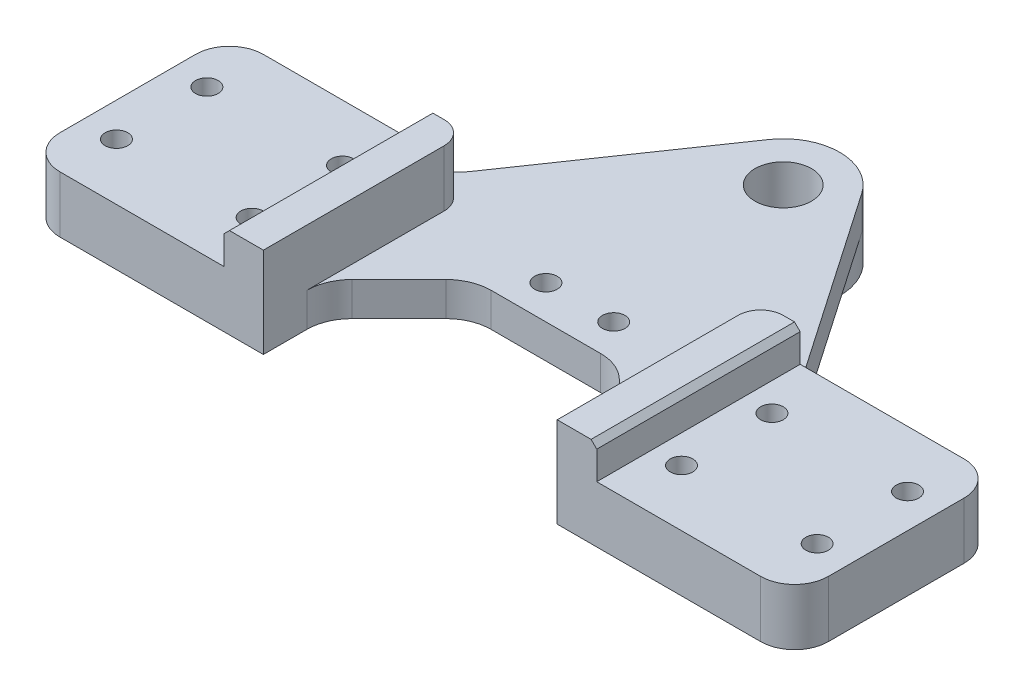
from build123d import *

# Parameters (mm, degrees)
SKETCH_1_R      = 2.5
SKETCH_1_R_2    = 1
EXTRUDE_1_DEPTH = 3
SKETCH_2_W      = 3.5
SKETCH_2_H      = 18
EXTRUDE_2_DEPTH = 5
SKETCH_5_W      = 17.5
SKETCH_5_H      = 18
SKETCH_5_R      = 1
EXTRUDE_4_DEPTH = 2
CHAMFER_1_SIZE  = 0.5
FILLET_1_R      = 3
EXTRUDE_START   = 3
SKETCH_3_R      = 5
SKETCH_3_R_2    = 2.5
EXTRUDE_3_DEPTH = 3
FILLET_2_R      = 2
FILLET_3_R      = 4


with BuildPart() as part:
    # 草图1 → 凸台-拉伸1 (new body)
    with BuildSketch(Plane(origin=(0, 0, 0), x_dir=(1, 0, 0), z_dir=(0, 1, 0))):
        with BuildLine():
            Line((-34, -33), (-34, -15))
            Line((-34, -15), (-19, -15))
            ThreePointArc((-19, -15), (-16.671267836, -14.424591112), (-14.878524946, -12.830802603))
            Line((-14.878524946, -12.830802603), (-4.121475054, 2.830802603))
            ThreePointArc((-4.121475054, 2.830802603), (0, 5), (4.121475054, 2.830802603))
            Line((4.121475054, 2.830802603), (14.878524946, -12.830802603))
            ThreePointArc((14.878524946, -12.830802603), (16.671267836, -14.424591112), (19, -15))
            Line((19, -15), (34, -15))
            Line((34, -15), (34, -33))
            Line((34, -33), (13, -33))
            Line((13, -33), (13, -27.5))
            Line((13, -27.5), (6.5, -21))
            Line((6.5, -21), (-6.5, -21))
            Line((-6.5, -21), (-13, -27.5))
            Line((-13, -27.5), (-13, -33))
            Line((-13, -33), (-34, -33))
        make_face()
        Circle(SKETCH_1_R, mode=Mode.SUBTRACT)
        with Locations((-19, -20)):
            Circle(SKETCH_1_R_2, mode=Mode.SUBTRACT)
        with Locations((-19, -28)):
            Circle(SKETCH_1_R_2, mode=Mode.SUBTRACT)
        with Locations((-31, -28)):
            Circle(SKETCH_1_R_2, mode=Mode.SUBTRACT)
        with Locations((-31, -20)):
            Circle(SKETCH_1_R_2, mode=Mode.SUBTRACT)
        with Locations((31, -28)):
            Circle(SKETCH_1_R_2, mode=Mode.SUBTRACT)
        with Locations((19, -28)):
            Circle(SKETCH_1_R_2, mode=Mode.SUBTRACT)
        with Locations((31, -20)):
            Circle(SKETCH_1_R_2, mode=Mode.SUBTRACT)
        with Locations((19, -20)):
            Circle(SKETCH_1_R_2, mode=Mode.SUBTRACT)
        with Locations((-3, -18)):
            Circle(SKETCH_1_R_2, mode=Mode.SUBTRACT)
        with Locations((3, -18)):
            Circle(SKETCH_1_R_2, mode=Mode.SUBTRACT)
    extrude(amount=EXTRUDE_1_DEPTH)

    # 草图2 → 凸台-拉伸2 (add)
    with BuildSketch(Plane(origin=(0, 3, 0), x_dir=(1, 0, 0), z_dir=(0, 1, 0))):
        with Locations((14.75, -24)):
            Rectangle(SKETCH_2_W, SKETCH_2_H)
        with Locations((-14.75, -24)):
            Rectangle(SKETCH_2_W, SKETCH_2_H)
    extrude(amount=EXTRUDE_2_DEPTH)

    # 草图5 → 凸台-拉伸4 (add)
    # profile 1 of 2: a face of its own
    with BuildSketch(Plane(origin=(0, 3, 0), x_dir=(1, 0, 0), z_dir=(0, 1, 0))):
        with Locations((25.25, -24)):
            Rectangle(SKETCH_5_W, SKETCH_5_H)
        with Locations((19, -28)):
            Circle(SKETCH_5_R, mode=Mode.SUBTRACT)
        with Locations((31, -28)):
            Circle(SKETCH_5_R, mode=Mode.SUBTRACT)
        with Locations((31, -20)):
            Circle(SKETCH_5_R, mode=Mode.SUBTRACT)
        with Locations((19, -20)):
            Circle(SKETCH_5_R, mode=Mode.SUBTRACT)
    # profile 2 of 2: a face of its own
    with BuildSketch(Plane(origin=(0, 3, 0), x_dir=(1, 0, 0), z_dir=(0, 1, 0))):
        with Locations((-25.25, -24)):
            Rectangle(SKETCH_5_W, SKETCH_5_H)
        with Locations((-31, -28)):
            Circle(SKETCH_5_R, mode=Mode.SUBTRACT)
        with Locations((-19, -28)):
            Circle(SKETCH_5_R, mode=Mode.SUBTRACT)
        with Locations((-19, -20)):
            Circle(SKETCH_5_R, mode=Mode.SUBTRACT)
        with Locations((-31, -20)):
            Circle(SKETCH_5_R, mode=Mode.SUBTRACT)
    extrude(amount=EXTRUDE_4_DEPTH)

    # 倒角1
    chamfer_1_edges = [part.edges().sort_by_distance(p)[0] for p in [
        (-16.5, 8, 24),
        (16.5, 8, 24),
    ]]
    chamfer(chamfer_1_edges, length=CHAMFER_1_SIZE)

    # 圆角1
    fillet_1_edges = [part.edges().sort_by_distance(p)[0] for p in [
        (-34, 2.5, 15),
        (-34, 2.5, 33),
        (34, 2.5, 15),
        (34, 2.5, 33),
    ]]
    fillet(fillet_1_edges, radius=FILLET_1_R)

    # 草图3 → 凸台-拉伸3 (add)
    with BuildSketch(Plane.XZ.offset(EXTRUDE_START)):
        Circle(SKETCH_3_R)
        Circle(SKETCH_3_R_2, mode=Mode.SUBTRACT)
    extrude(amount=-EXTRUDE_3_DEPTH)

    # 圆角2
    fillet_2_edges = [part.edges().sort_by_distance(p)[0] for p in [
        (-13, 5.5, 15),
        (13, 5.5, 15),
    ]]
    fillet(fillet_2_edges, radius=FILLET_2_R)

    # 圆角3
    fillet_3_edges = [part.edges().sort_by_distance(p)[0] for p in [
        (13, 1.5, 27.5),
        (6.5, 1.5, 21),
        (-13, 1.5, 27.5),
        (-6.5, 1.5, 21),
    ]]
    fillet(fillet_3_edges, radius=FILLET_3_R)


solid = part.part
